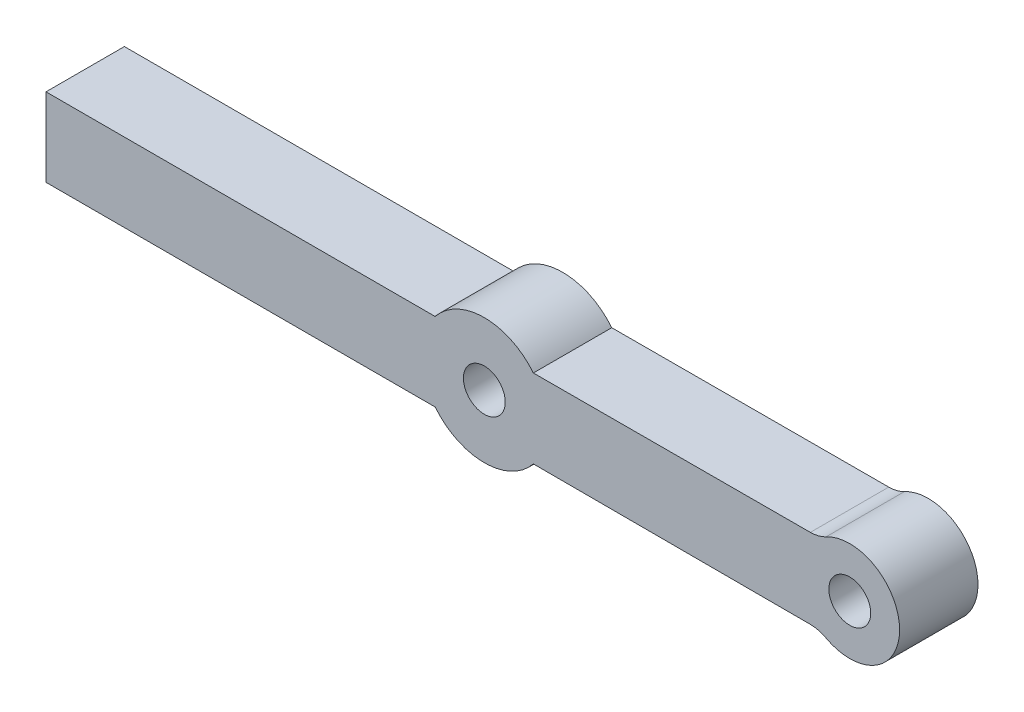
from build123d import *

# Parameters (mm, degrees)
SKETCH1_R           = 1.6
BOSS_EXTRUDE1_DEPTH = 5.9944


with BuildPart() as part:
    # Sketch1 → Boss-Extrude1 (new body)
    with BuildSketch(Plane.XY):
        with BuildLine():
            Line((-31.75, 2.9972), (-37.7444, 2.9972))
            Line((-37.7444, 2.9972), (-42.403721744, 2.9972))
            Line((-42.403721744, 2.9972), (-61.453721744, 2.9972))
            Line((-61.453721744, 2.9972), (-61.453721744, -2.9972))
            Line((-61.453721744, -2.9972), (-55.103721744, -2.9972))
            Line((-55.103721744, -2.9972), (-42.403721744, -2.9972))
            Line((-42.403721744, -2.9972), (-37.7444, -2.9972))
            Line((-37.7444, -2.9972), (-31.75, -2.9972))
            Line((-31.75, -2.9972), (-31.698156417, -2.997289385))
            ThreePointArc((-31.698156417, -2.997289385), (-27.948287961, -4.807017227), (-24.192201377, -3.010230687))
            Line((-24.192201377, -3.010230687), (-3.01403503, -3.046744767))
            ThreePointArc((-3.01403503, -3.046744767), (-2.393607559, -3.124787196), (-1.8110486, -3.352044595))
            ThreePointArc((-1.8110486, -3.352044595), (3.81, 0), (-1.8110486, 3.352044595))
            ThreePointArc((-1.8110486, 3.352044595), (-2.393607559, 3.124787196), (-3.01403503, 3.046744767))
            Line((-3.01403503, 3.046744767), (-24.192201377, 3.010230687))
            ThreePointArc((-24.192201377, 3.010230687), (-27.948287961, 4.807017227), (-31.698156417, 2.997289385))
            Line((-31.698156417, 2.997289385), (-31.75, 2.9972))
        make_face()
        Circle(SKETCH1_R, mode=Mode.SUBTRACT)
        with Locations((-27.94, 0)):
            Circle(SKETCH1_R, mode=Mode.SUBTRACT)
    extrude(amount=BOSS_EXTRUDE1_DEPTH)


solid = part.part
